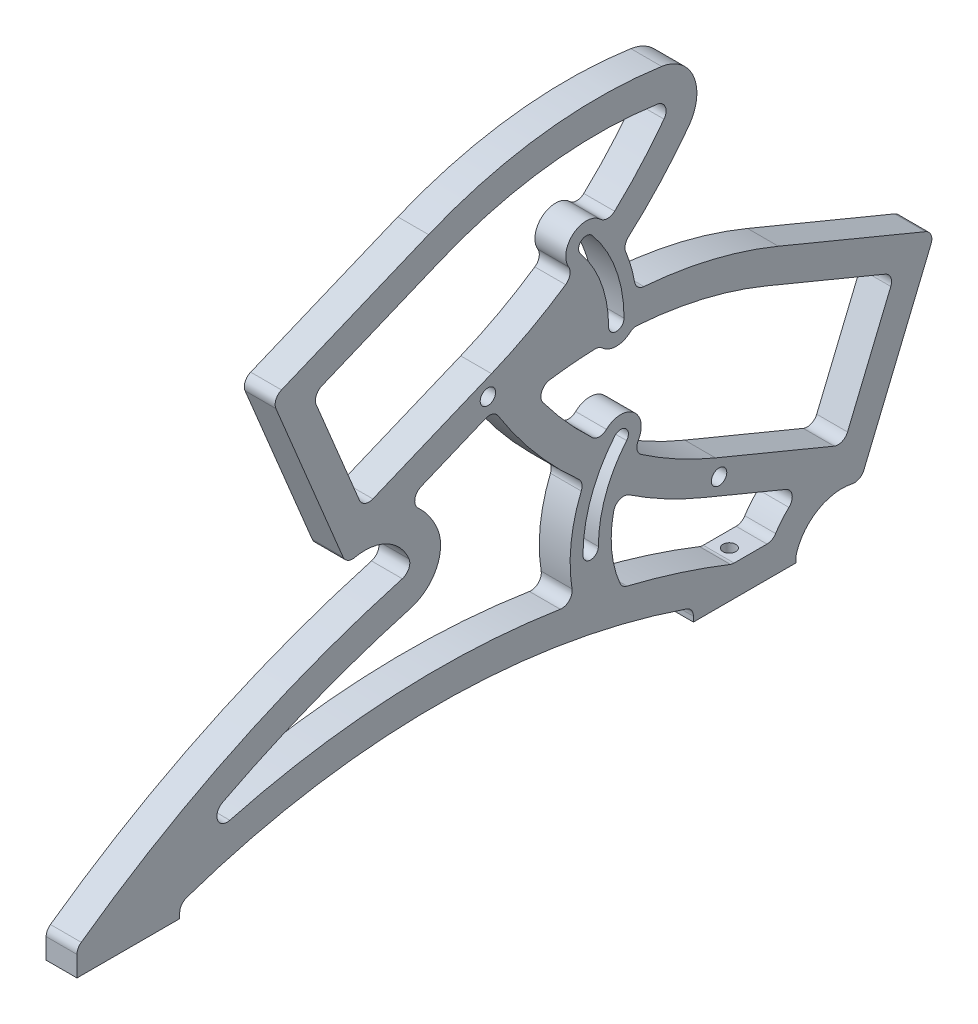
from build123d import *

# Parameters (mm, degrees)
SKETCH1_R                   = 1.5
BOSS_EXTRUDE1_DEPTH         = 6
FILLET1_R                   = 2
TAP_DRILL_FOR_M3_TAP1_D     = 2.5
TAP_DRILL_FOR_M3_TAP1_DEPTH = 10
TAP_DRILL_FOR_M3_TAP1_TIP   = 0.751075774


with BuildPart() as part:
    # Sketch1 → Boss-Extrude1 (new body)
    with BuildSketch(Plane(origin=(0, 0, 0), x_dir=(0, 0, -1), z_dir=(1, 0, 0))):
        with BuildLine():
            Line((0, 0), (0, 5))
            ThreePointArc((0, 5), (30.306872644, 23.131839172), (63.330515184, 35.650191885))
            ThreePointArc((63.330515184, 35.650191885), (64.588559877, 36.701940492), (64.63724154, 38.340989509))
            ThreePointArc((64.63724154, 38.340989509), (59.61305605, 43.365174999), (52.507784789, 43.365174999))
            Line((52.507784789, 43.365174999), (37.965814359, 78.472597235))
            Line((37.965814359, 78.472597235), (68.453838932, 91.101150503))
            ThreePointArc((68.453838932, 91.101150503), (90.75830388, 96.999189804), (113.828292623, 96.77193757))
            ThreePointArc((113.828292623, 96.77193757), (120.071041901, 91.916244219), (119.090245249, 84.068460175))
            ThreePointArc((119.090245249, 84.068460175), (113.049914532, 76.838922764), (106.256946475, 70.311489017))
            ThreePointArc((106.256946475, 70.311489017), (107.872116673, 66.009064376), (108.787347676, 61.505511914))
            ThreePointArc((108.787347676, 61.505511914), (122.933070277, 59.457640443), (136.546161068, 55.101150503))
            Line((136.546161068, 55.101150503), (167.034185641, 42.472597235))
            Line((167.034185641, 42.472597235), (152.492215211, 7.365174999))
            ThreePointArc((152.492215211, 7.365174999), (145.029217261, 7.208101321), (140.094434117, 1.607304426))
            ThreePointArc((140.094434117, 1.607304426), (140.023749539, 1.307301346), (140, 1))
            Line((140, 1), (140, 0))
            Line((140, 0), (120, 0))
            Line((120, 0), (120, 1))
            ThreePointArc((120, 1), (119.627466942, 2.162476387), (118.648648649, 2.891891892))
            ThreePointArc((118.648648649, 2.891891892), (70, 11), (21.351351351, 2.891891892))
            ThreePointArc((21.351351351, 2.891891892), (20.372533058, 2.162476387), (20, 1))
            Line((20, 1), (20, 0))
            Line((20, 0), (0, 0))
        make_face()
        with Locations((80, 58)):
            Circle(SKETCH1_R, mode=Mode.SUBTRACT)
        with Locations((125, 22)):
            Circle(SKETCH1_R, mode=Mode.SUBTRACT)
        with BuildLine():
            Line((63.72452745, 48.011301935), (81.11114338, 55.213074057))
            ThreePointArc((81.11114338, 55.213074057), (89.093260239, 44.058882229), (98.743053525, 34.311489017))
            ThreePointArc((98.743053525, 34.311489017), (96.120508219, 24.64101391), (96.9455023, 14.655263189))
            ThreePointArc((96.9455023, 14.655263189), (53.555187376, 16.130809763), (11.438572835, 5.591006803))
            ThreePointArc((11.438572835, 5.591006803), (37.27128416, 19.770562369), (64.953613309, 29.873899607))
            ThreePointArc((64.953613309, 29.873899607), (69.985792082, 34.080894036), (70.180518735, 40.637090103))
            ThreePointArc((70.180518735, 40.637090103), (67.559666076, 44.855738901), (63.72452745, 48.011301935))
        make_face(mode=Mode.SUBTRACT)
        with BuildLine():
            Line((80.699708768, 61.537005462), (55.75496139, 51.204552788))
            Line((55.75496139, 51.204552788), (45.805192149, 75.225420634))
            Line((45.805192149, 75.225420634), (70.749939526, 85.557873308))
            ThreePointArc((70.749939526, 85.557873308), (91.502380524, 91.045506075), (112.967077451, 90.834066872))
            ThreePointArc((112.967077451, 90.834066872), (114.527764673, 89.620143611), (114.282565525, 87.658197723))
            ThreePointArc((114.282565525, 87.658197723), (109.007019808, 81.303334108), (103.10607381, 75.524535746))
            ThreePointArc((103.10607381, 75.524535746), (102.66755418, 76.088172585), (102.21528885, 76.640840681))
            ThreePointArc((102.21528885, 76.640840681), (96.579960639, 77.133868015), (96.086933305, 71.498539803))
            ThreePointArc((96.086933305, 71.498539803), (96.4758084, 71.021049787), (96.850515773, 70.532362833))
            ThreePointArc((96.850515773, 70.532362833), (89.035079567, 65.567923188), (80.699708768, 61.537005462))
        make_face(mode=Mode.SUBTRACT)
        with BuildLine():
            Line((124.300291232, 25.537005462), (149.24503861, 15.204552788))
            Line((149.24503861, 15.204552788), (159.194807851, 39.225420634))
            Line((159.194807851, 39.225420634), (134.250060474, 49.557873308))
            ThreePointArc((134.250060474, 49.557873308), (121.450314093, 53.641995786), (108.148496928, 55.532822038))
            ThreePointArc((108.148496928, 55.532822038), (104.929684106, 54.000618088), (101.766721463, 55.645024437))
            ThreePointArc((101.766721463, 55.645024437), (96.887469134, 55.387817162), (92.032922859, 54.834066917))
            ThreePointArc((92.032922859, 54.834066917), (90.472235487, 53.620143544), (90.717434663, 51.658197472))
            ThreePointArc((90.717434663, 51.658197472), (95.992980298, 45.303333993), (101.89392619, 39.524535746))
            ThreePointArc((101.89392619, 39.524535746), (102.33244582, 40.088172585), (102.78471115, 40.640840681))
            ThreePointArc((102.78471115, 40.640840681), (108.420039361, 41.133868015), (108.913066695, 35.498539803))
            ThreePointArc((108.913066695, 35.498539803), (108.5241916, 35.021049787), (108.149484227, 34.532362833))
            ThreePointArc((108.149484227, 34.532362833), (115.964920433, 29.567923188), (124.300291232, 25.537005462))
        make_face(mode=Mode.SUBTRACT)
        with BuildLine():
            Line((122.004190638, 19.993728267), (141.27547255, 12.011301935))
            ThreePointArc((141.27547255, 12.011301935), (137.950950961, 9.410732752), (135.464526627, 6))
            Line((135.464526627, 6), (127.541289523, 6))
            ThreePointArc((127.541289523, 6), (116.964502802, 9.762681734), (106.144506127, 12.754982379))
            ThreePointArc((106.144506127, 12.754982379), (104.029107455, 20.894710056), (105.277139326, 29.211710396))
            ThreePointArc((105.277139326, 29.211710396), (113.384661496, 24.138172602), (122.004190638, 19.993728267))
        make_face(mode=Mode.SUBTRACT)
        with BuildLine():
            ThreePointArc((106.5, 58), (104.901854451, 67.063533798), (100.300177743, 75.033871657))
            ThreePointArc((100.300177743, 75.033871657), (98.186929663, 75.218756907), (98.002044413, 73.105508828))
            ThreePointArc((98.002044413, 73.105508828), (102.082776588, 66.037473368), (103.5, 58))
            ThreePointArc((103.5, 58), (105, 56.5), (106.5, 58))
        make_face(mode=Mode.SUBTRACT)
        with BuildLine():
            ThreePointArc((104.699822257, 39.033871657), (100.098145549, 31.063533798), (98.5, 22))
            ThreePointArc((98.5, 22), (100, 20.5), (101.5, 22))
            ThreePointArc((101.5, 22), (102.917223412, 30.037473368), (106.997955587, 37.105508828))
            ThreePointArc((106.997955587, 37.105508828), (106.813070337, 39.218756907), (104.699822257, 39.033871657))
        make_face(mode=Mode.SUBTRACT)
    extrude(amount=BOSS_EXTRUDE1_DEPTH)

    # Fillet1
    fillet1_edges = [part.edges().sort_by_distance(p)[0] for p in [
        (3, 14.655263189, -96.9455023),
        (3, 34.311489017, -98.743053525),
        (3, 12.754982379, -106.144506127),
        (3, 12.011301935, -141.27547255),
        (3, 6, -135.464526627),
        (3, 6, -127.541289523),
        (3, 39.524535746, -101.89392619),
        (3, 34.532362833, -108.149484227),
        (3, 15.204552788, -149.24503861),
        (3, 39.225420634, -159.194807851),
        (3, 42.472597235, -167.034185641),
        (3, 7.365174999, -152.492215211),
        (3, 75.524535746, -103.10607381),
        (3, 70.532362833, -96.850515773),
        (3, 51.204552788, -55.75496139),
        (3, 78.472597235, -37.965814359),
        (3, 75.225420634, -45.805192149),
        (3, 43.365174999, -52.507784789),
        (3, 48.011301935, -63.72452745),
        (3, 5.591006803, -11.438572835),
        (3, 5, 0),
        (3, 55.532822038, -108.148496928),
        (3, 55.645024437, -101.766721463),
        (3, 61.505511914, -108.787347676),
        (3, 70.311489017, -106.256946475),
        (3, 29.211710396, -105.277139326),
        (3, 55.213074057, -81.11114338),
    ]]
    fillet(fillet1_edges, radius=FILLET1_R)

    # Tap Drill for M3 Tap1
    with Locations(Plane(origin=(0, 0, 0), x_dir=(-1, 0, 0), z_dir=(0, -1, 0))):
        with Locations((-3, 10), (-3, 130)):
            Hole(TAP_DRILL_FOR_M3_TAP1_D / 2, depth=TAP_DRILL_FOR_M3_TAP1_DEPTH)
            with Locations((0, 0, -(TAP_DRILL_FOR_M3_TAP1_DEPTH + TAP_DRILL_FOR_M3_TAP1_TIP / 2))):  # 118° drill point
                Cone(0, TAP_DRILL_FOR_M3_TAP1_D / 2, TAP_DRILL_FOR_M3_TAP1_TIP, mode=Mode.SUBTRACT)


solid = part.part
